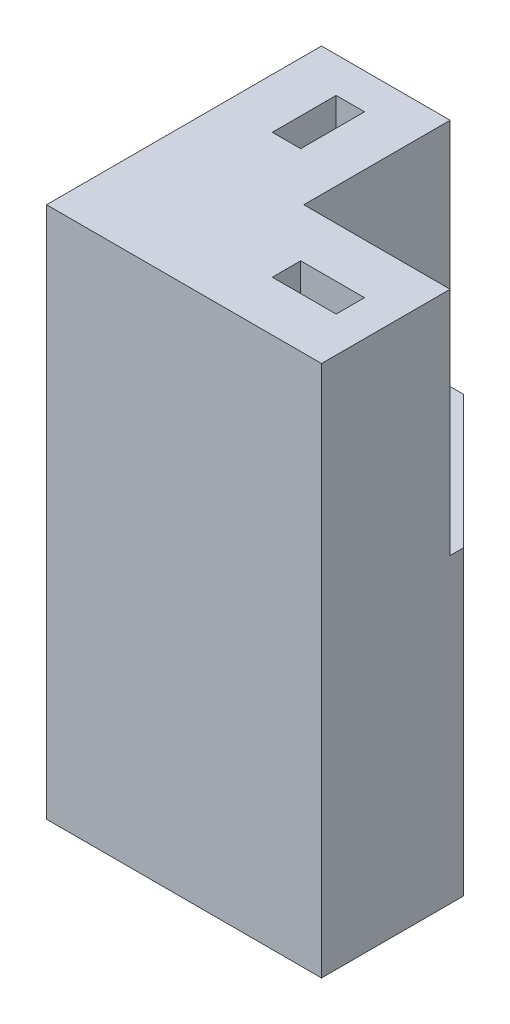
from build123d import *

# Parameters (mm, degrees)
SKETCH3_W           = 19.685
SKETCH3_H           = 19.685
BOSS_EXTRUDE2_DEPTH = 38.1
SKETCH6_W           = 10.4775
SKETCH6_H           = 10.4775
CUT_EXTRUDE3_DEPTH  = 16.51
SKETCH7_W           = 2.032
SKETCH7_H           = 4.572
SKETCH7_W_2         = 4.572
SKETCH7_H_2         = 2.032
CUT_EXTRUDE4_DEPTH  = 5.08
CHAMFER1_SIZE       = 9.525


with BuildPart() as part:
    # Sketch3 → Boss-Extrude2 (new body)
    with BuildSketch(Plane(origin=(0, 0, 0), x_dir=(1, 0, 0), z_dir=(0, 1, 0))):
        Rectangle(SKETCH3_W, SKETCH3_H)
    extrude(amount=BOSS_EXTRUDE2_DEPTH)

    # Sketch6 → Cut-Extrude3 (cut)
    with BuildSketch(Plane(origin=(0, 38.1, 0), x_dir=(1, 0, 0), z_dir=(0, 1, 0))):
        with Locations((4.60375, 4.60375)):
            Rectangle(SKETCH6_W, SKETCH6_H)
    extrude(amount=-CUT_EXTRUDE3_DEPTH, mode=Mode.SUBTRACT)

    # Sketch7 → Cut-Extrude4 (cut)
    with BuildSketch(Plane(origin=(0, 38.1, 0), x_dir=(1, 0, 0), z_dir=(0, 1, 0))):
        with Locations((-5.23875, 5.0165)):
            Rectangle(SKETCH7_W, SKETCH7_H)
        with Locations((5.0165, -5.23875)):
            Rectangle(SKETCH7_W_2, SKETCH7_H_2)
    extrude(amount=-CUT_EXTRUDE4_DEPTH, mode=Mode.SUBTRACT)

    # Chamfer1
    chamfer1_edges = [part.edges().sort_by_distance(p)[0] for p in [
        (9.8425, 10.795, -9.8425),
    ]]
    chamfer(chamfer1_edges, length=CHAMFER1_SIZE)


solid = part.part
